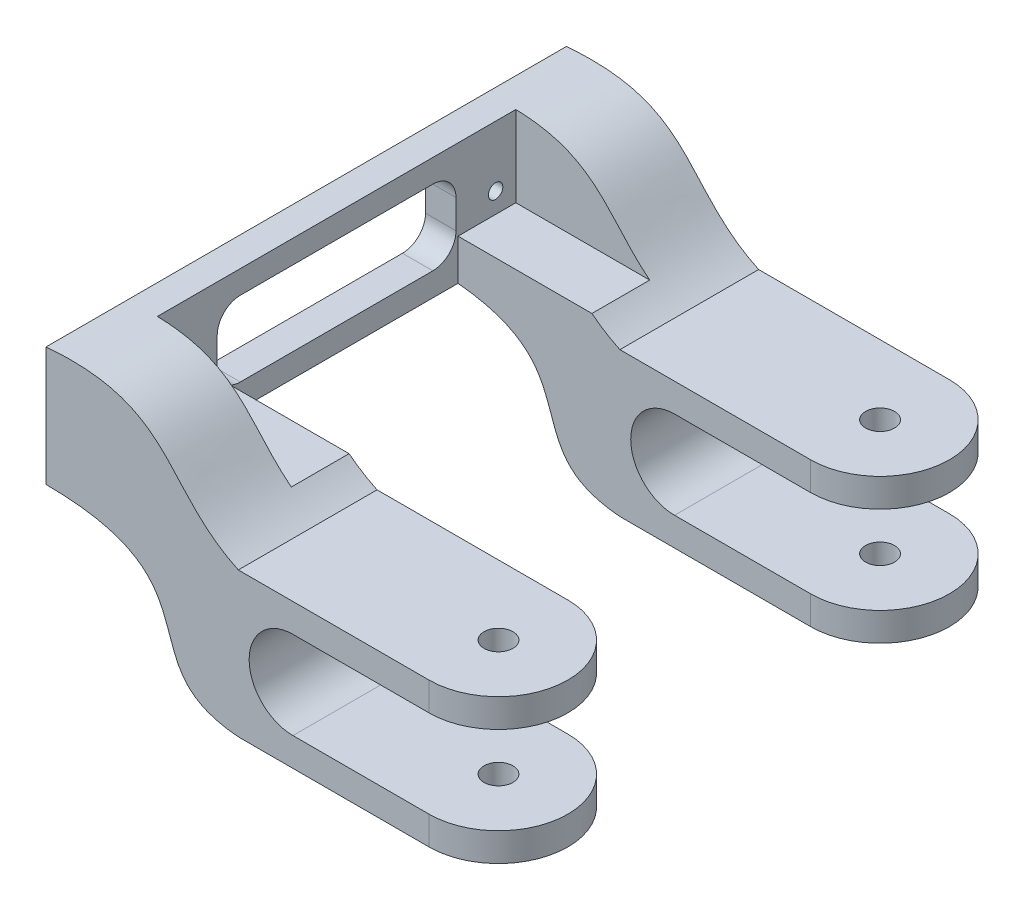
from build123d import *
from OCP.BRepAlgoAPI import BRepAlgoAPI_Cut
from OCP.TopTools import TopTools_ListOfShape

# Parameters (mm, degrees)
BOSS_EXTRUDE1_DEPTH = 140
SKETCH2_W           = 45
SKETCH2_H           = 25
SKETCH2_H_2         = 42
CUT_EXTRUDE1_DEPTH  = 151.712117272
SKETCH3_W           = 25
SKETCH3_H           = 58.39699261
SKETCH3_H_2         = 53.941763905
CUT_EXTRUDE2_DEPTH  = 149.913368614
CUT_EXTRUDE3_START  = -25
CUT_EXTRUDE3_DEPTH  = 25
SKETCH5_R           = 2.5
CUT_EXTRUDE4_DEPTH  = 128.82465442
SKETCH6_W           = 42
SKETCH6_H           = 41.970965134
CUT_EXTRUDE5_DEPTH  = 28
M3_TAPPED_HOLE1_D   = 2.5
CUT_EXTRUDE7_DEPTH  = 10
CUT_EXTRUDE8_DEPTH  = 10
CUT_EXTRUDE9_DEPTH  = 142.067055339


with BuildPart() as part:
    # Sketch1 → Boss-Extrude1 (new body)
    with BuildSketch(Plane.XY):
        with BuildLine():
            Line((-28.369303649, 18.31966037), (-28.369303649, -2.282608696))
            add(Edge.make_bspline(
                [(-28.369303649, -2.282608696), (2.684029018, -2.430944497), (-15.214915802, -21.968601645), (5.015839683, -23.456157195)],
                knots=[0, 0, 0, 0, 1, 1, 1, 1], degree=3))
            Line((5.015839683, -23.456157195), (49.891304348, -23.456157195))
            Line((49.891304348, -23.456157195), (49.891304348, -18.537678935))
            Line((49.891304348, -18.537678935), (14.347826087, -18.537678935))
            ThreePointArc((14.347826087, -18.537678935), (6.766304348, -10.956157195), (14.347826087, -3.374635456))
            Line((14.347826087, -3.374635456), (49.891304348, -3.374635456))
            Line((49.891304348, -3.374635456), (49.891304348, 1.543842805))
            Line((49.891304348, 1.543842805), (4.891304348, 1.543842805))
            add(Edge.make_bspline(
                [(-28.369303649, 18.31966037), (-6.165269931, 20.270771045), (-8.304675764, 7.778503855), (4.891304348, 1.543842805)],
                knots=[0, 0, 0, 0, 1, 1, 1, 1], degree=3))
        make_face()
    extrude(amount=BOSS_EXTRUDE1_DEPTH)

    # Sketch2 → Cut-Extrude1 (cut, through all)
    with BuildSketch(Plane(origin=(0, 1.543842805, 0), x_dir=(1, 0, 0), z_dir=(0, 1, 0))):
        with Locations((27.391304348, -12.5)):
            Rectangle(SKETCH2_W, SKETCH2_H)
        with Locations((27.391304348, -70)):
            Rectangle(SKETCH2_W, SKETCH2_H_2)
        with Locations((27.391304348, -127.5)):
            Rectangle(SKETCH2_W, SKETCH2_H)
    extrude(amount=-CUT_EXTRUDE1_DEPTH, mode=Mode.SUBTRACT)

    # Sketch3 → Cut-Extrude2 (cut, through all)
    with BuildSketch(Plane(origin=(4.891304348, 0, 0), x_dir=(0, 0, -1), z_dir=(1, 0, 0))):
        with Locations((-127.5, 5.751761195)):
            Rectangle(SKETCH3_W, SKETCH3_H)
        with Locations((-12.5, 3.524146843)):
            Rectangle(SKETCH3_W, SKETCH3_H_2)
    extrude(amount=-CUT_EXTRUDE2_DEPTH, mode=Mode.SUBTRACT)


with BuildPart() as cut_extrude3_tool:
    # Cut-Extrude3: read off the stored shape, not the designer's step
    # Cut-Extrude3 outline → Cut-Extrude3 (new body)
    with BuildSketch(Plane(origin=(0, 1.543842805, 0), x_dir=(1, 0, 0), z_dir=(0, 1, 0)).offset(CUT_EXTRUDE3_START)):
        with BuildLine():
            ThreePointArc((37.891304348, -91), (46.376584834, -94.514719112), (49.891302974, -103))
            Line((49.891302974, -103), (49.891304348, -91))
            Line((49.891304348, -91), (37.891304348, -91))
        make_face()
        with BuildLine():
            ThreePointArc((49.891302974, -103), (46.376583863, -111.48528186), (37.891301601, -115))
            Line((37.891301601, -115), (49.891304348, -115))
            Line((49.891304348, -115), (49.891302974, -103))
        make_face()
        with BuildLine():
            ThreePointArc((37.891303148, -25), (46.376585298, -28.514718201), (49.891304348, -37))
            Line((49.891304348, -37), (49.891304348, -25))
            Line((49.891304348, -25), (37.891303148, -25))
        make_face()
        with BuildLine():
            ThreePointArc((49.891304348, -37), (46.376585294, -45.485281802), (37.891303138, -49))
            Line((37.891303138, -49), (49.891304348, -49))
            Line((49.891304348, -49), (49.891304348, -37))
        make_face()
    extrude(amount=CUT_EXTRUDE3_DEPTH)


with BuildPart() as part_1:
    add(part.part)

    # Cut-Extrude3: cut by cut_extrude3_tool, with a tolerance
    cut_extrude3_stock = TopTools_ListOfShape()
    cut_extrude3_stock.Append(part_1.part.wrapped)
    cut_extrude3_tools = TopTools_ListOfShape()
    cut_extrude3_tools.Append(cut_extrude3_tool.part.wrapped)
    cut_extrude3_cut = BRepAlgoAPI_Cut()
    cut_extrude3_cut.SetArguments(cut_extrude3_stock)
    cut_extrude3_cut.SetTools(cut_extrude3_tools)
    cut_extrude3_cut.SetFuzzyValue(0.00001)
    cut_extrude3_cut.Build()
    add(Compound.cast(cut_extrude3_cut.Shape()).solids(), mode=Mode.REPLACE)

    # Sketch5 → Cut-Extrude4 (cut, through all)
    with BuildSketch(Plane(origin=(0, 1.543842805, 0), x_dir=(1, 0, 0), z_dir=(0, 1, 0))):
        with Locations(Location((37.891304348, -37, 0), (0, 0, 180))):
            Circle(SKETCH5_R)
        with Locations(Location((37.891302974, -103, 0), (0, 0, 180))):
            Circle(SKETCH5_R)
    extrude(amount=-CUT_EXTRUDE4_DEPTH, mode=Mode.SUBTRACT)

    # Sketch6 → Cut-Extrude5 (cut)
    with BuildSketch(Plane(origin=(4.891304348, 0, 0), x_dir=(0, 0, -1), z_dir=(1, 0, 0))):
        with Locations((-70, -2.461252543)):
            Rectangle(SKETCH6_W, SKETCH6_H)
    extrude(amount=-CUT_EXTRUDE5_DEPTH, mode=Mode.SUBTRACT)

    # M3 Tapped Hole1 (through all)
    with Locations(Plane(origin=(-28.369303649, 8.053562831, 42.5), x_dir=(0, -1, 0), z_dir=(-1, 0, 0))):
        with Locations((0, 0), (0, 55)):
            Hole(M3_TAPPED_HOLE1_D / 2)

    # Sketch10 → Cut-Extrude7 (cut)
    with BuildSketch(Plane(origin=(0, 0, 91), x_dir=(-1, 0, 0), z_dir=(0, 0, -1))):
        Polygon((-6.055554522, 4.543842805), (23.108695652, 4.543842805), (23.108695652, 21.156391706), (-12.385539101, 21.156391706), align=None)
    extrude(amount=-CUT_EXTRUDE7_DEPTH, mode=Mode.SUBTRACT)

    # Sketch12 → Cut-Extrude8 (cut)
    with BuildSketch(Plane.XY.offset(49)):
        Polygon((10.285273621, 4.543842805), (-23.108695652, 4.543842805), (-23.108695652, 23.852692611), (13.93451424, 23.852692611), align=None)
    extrude(amount=-CUT_EXTRUDE8_DEPTH, mode=Mode.SUBTRACT)

    # Sketch13 → Cut-Extrude9 (cut, through all)
    with BuildSketch(Plane.ZY.offset(28.369303649)):
        with BuildLine():
            Line((86.648776757, 1.525435208), (53.351223243, 1.525435208))
            ThreePointArc((53.351223243, 1.525435208), (50.522796118, 2.697008083), (49.351223243, 5.525435208))
            Line((49.351223243, 5.525435208), (49.351223243, 10.511616467))
            ThreePointArc((49.351223243, 10.511616467), (50.522796118, 13.340043592), (53.351223243, 14.511616467))
            Line((53.351223243, 14.511616467), (86.648776757, 14.511616467))
            ThreePointArc((86.648776757, 14.511616467), (89.477203882, 13.340043592), (90.648776757, 10.511616467))
            Line((90.648776757, 10.511616467), (90.648776757, 5.525435208))
            ThreePointArc((90.648776757, 5.525435208), (89.477203882, 2.697008083), (86.648776757, 1.525435208))
        make_face()
    extrude(amount=-CUT_EXTRUDE9_DEPTH, mode=Mode.SUBTRACT)


solid = part_1.part
